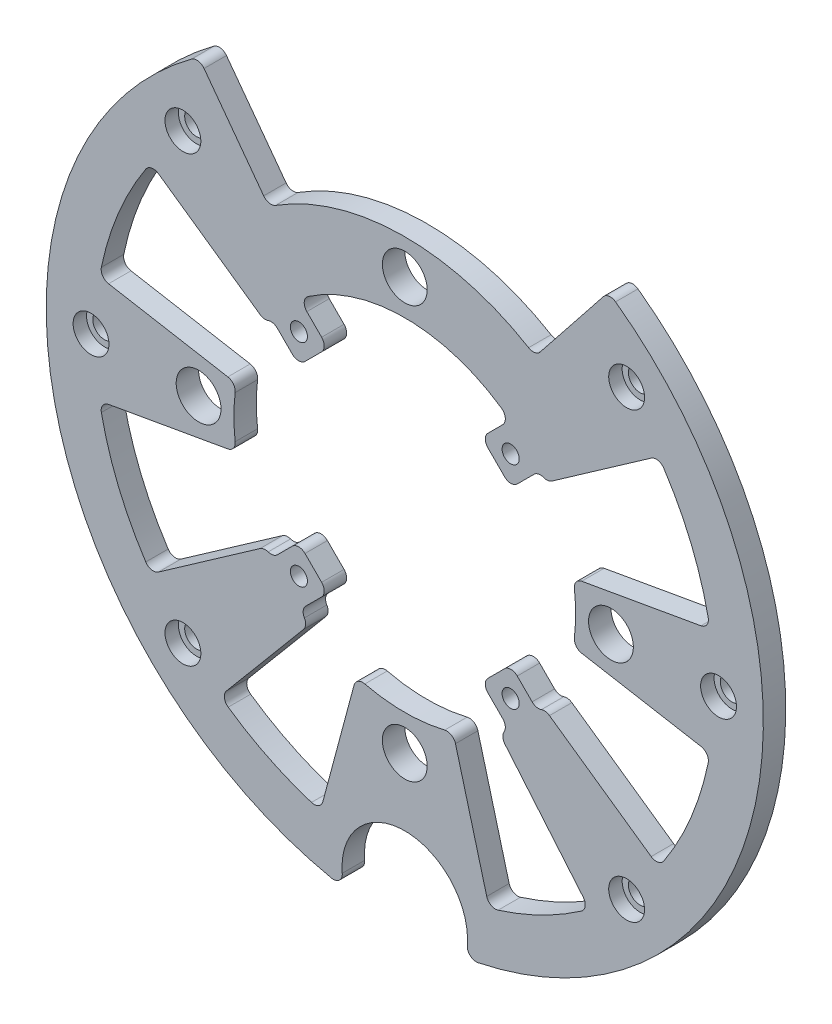
from build123d import *

# Parameters (mm, degrees)
SKETCH1_R                                        = 101.6
SKETCH1_R_2                                      = 48.435876627
EXTRUDE1_DEPTH                                   = 6.35
CBORE_FOR_1_4_SOCKET_HEAD_CAP_SCREW1_D           = 6.6294
CBORE_FOR_1_4_SOCKET_HEAD_CAP_SCREW1_CBORE_D     = 10.16
CBORE_FOR_1_4_SOCKET_HEAD_CAP_SCREW1_CBORE_DEPTH = 3.81
SKETCH11_R                                       = 17.78
CUT_EXTRUDE1_DEPTH                               = 144.824345992
SKETCH12_R                                       = 6.35
CUT_EXTRUDE2_DEPTH                               = 144.824345992
SKETCH13_R                                       = 2.426498152
EXTRUDE2_DEPTH                                   = 6.35
CUT_EXTRUDE3_DEPTH                               = 6.35
FILLET1_R                                        = 2.54
FILLET2_R                                        = 2.54
FILLET3_R                                        = 2.54
FILLET4_R                                        = 2.54
FILLET5_R                                        = 2.54
FILLET6_R                                        = 2.54
FILLET9_R                                        = 2.54


with BuildPart() as part:
    # Sketch1 → Extrude1 (new body)
    with BuildSketch(Plane.XY):
        Circle(SKETCH1_R)
        Circle(SKETCH1_R_2, mode=Mode.SUBTRACT)
    extrude(amount=EXTRUDE1_DEPTH)

    # CBORE for 1/4 Socket Head Cap Screw1 (through all)
    with Locations(Plane.XY.offset(6.35)):
        with Locations((62.861792847, -62.861792847), (88.9, 0), (62.861792847, 62.861792847), (-62.861792847, 62.861792847), (-88.9, 0), (-62.861792847, -62.861792847)):
            CounterBoreHole(CBORE_FOR_1_4_SOCKET_HEAD_CAP_SCREW1_D / 2, CBORE_FOR_1_4_SOCKET_HEAD_CAP_SCREW1_CBORE_D / 2, CBORE_FOR_1_4_SOCKET_HEAD_CAP_SCREW1_CBORE_DEPTH)

    # Sketch11 → Cut-Extrude1 (cut, through all)
    with BuildSketch(Plane.XY.offset(6.35)):
        with Locations((0, -95.25)):
            Circle(SKETCH11_R)
    extrude(amount=-CUT_EXTRUDE1_DEPTH, mode=Mode.SUBTRACT)

    # Sketch12 → Cut-Extrude2 (cut, through all)
    with BuildSketch(Plane.XY.offset(6.35)):
        with Locations((0, -58.42)):
            Circle(SKETCH12_R)
        with Locations((-58.42, 0)):
            Circle(SKETCH12_R)
        with Locations((58.42, 0)):
            Circle(SKETCH12_R)
        with Locations(Location((0, 58.42, 0), (0, 0, 180))):
            Circle(SKETCH12_R)
    extrude(amount=-CUT_EXTRUDE2_DEPTH, mode=Mode.SUBTRACT)

    # Sketch13 → Extrude2 (add)
    # profile 1 of 4: a face of its own
    with BuildSketch(Plane.XY.offset(6.35)):
        Polygon((30.067243726, -21.76182967), (44.903973325, -36.598559269), (36.598559269, -44.903973325), (21.76182967, -30.067243726), align=None)
        with Locations((29.99994, -29.99994)):
            Circle(SKETCH13_R, mode=Mode.SUBTRACT)
    # profile 2 of 4: a face of its own
    with BuildSketch(Plane.XY.offset(6.35)):
        Polygon((-30.067243726, -21.76182967), (-44.903973325, -36.598559269), (-36.598559269, -44.903973325), (-21.76182967, -30.067243726), align=None)
        with Locations((-29.99994, -29.99994)):
            Circle(SKETCH13_R, mode=Mode.SUBTRACT)
    # profile 3 of 4: a face of its own
    with BuildSketch(Plane.XY.offset(6.35)):
        Polygon((-30.067243726, 21.76182967), (-21.76182967, 30.067243726), (-36.598559269, 44.903973325), (-44.903973325, 36.598559269), align=None)
        with Locations((-29.99994, 29.99994)):
            Circle(SKETCH13_R, mode=Mode.SUBTRACT)
    # profile 4 of 4: a face of its own
    with BuildSketch(Plane.XY.offset(6.35)):
        Polygon((30.067243726, 21.76182967), (21.76182967, 30.067243726), (36.598559269, 44.903973325), (44.903973325, 36.598559269), align=None)
        with Locations((29.99994, 29.99994)):
            Circle(SKETCH13_R, mode=Mode.SUBTRACT)
    extrude(amount=-EXTRUDE2_DEPTH)

    # Sketch14 → Cut-Extrude3 (cut)
    with BuildSketch(Plane.XY.offset(6.35)):
        with BuildLine():
            Line((36.978423652, 57.45466439), (71.6832833, 101.141012966))
            Line((71.6832833, 101.141012966), (0, 148.475476712))
            Line((0, 148.475476712), (-71.6832833, 101.141012966))
            Line((-71.6832833, 101.141012966), (-38.544806548, 56.41577939))
            ThreePointArc((-38.544806548, 56.41577939), (-0.939792187, 68.319536493), (36.978423652, 57.45466439))
        make_face()
        with BuildLine():
            Line((8.652633897, -27.580853172), (23.900424698, -84.486383146))
            ThreePointArc((23.900424698, -84.486383146), (38.731626442, -78.797464115), (52.295107345, -70.52943347))
            Line((52.295107345, -70.52943347), (14.227637724, -25.162389788))
            ThreePointArc((14.227637724, -25.162389788), (11.503866682, -26.518532886), (8.652633897, -27.580853172))
        make_face()
        with BuildLine():
            Line((-71.923131973, 50.361119179), (-23.678617266, 16.579946304))
            ThreePointArc((-23.678617266, 16.579946304), (-26.705896668, 11.061944595), (-28.467103301, 5.019518375))
            Line((-28.467103301, 5.019518375), (-86.468023222, 15.246645463))
            ThreePointArc((-86.468023222, 15.246645463), (-81.118407757, 33.600344651), (-71.923131973, 50.361119179))
        make_face()
        with BuildLine():
            Line((-8.652154992, -27.581003409), (-23.900424698, -84.486383146))
            ThreePointArc((-23.900424698, -84.486383146), (-38.731626442, -78.797464115), (-52.295107345, -70.52943347))
            Line((-52.295107345, -70.52943347), (-14.229539169, -25.161314554))
            ThreePointArc((-14.229539169, -25.161314554), (-11.504638432, -26.518198083), (-8.652154992, -27.581003409))
        make_face()
        with BuildLine():
            Line((-86.468023222, -15.246645463), (-28.467103301, -5.019518375))
            ThreePointArc((-28.467103301, -5.019518375), (-26.705896668, -11.061944595), (-23.678617266, -16.579946304))
            Line((-23.678617266, -16.579946304), (-71.923131973, -50.361119179))
            ThreePointArc((-71.923131973, -50.361119179), (-81.118407757, -33.600344651), (-86.468023222, -15.246645463))
        make_face()
        with BuildLine():
            Line((23.678617266, -16.579946304), (71.923131973, -50.361119179))
            ThreePointArc((71.923131973, -50.361119179), (81.118407757, -33.600344651), (86.468023222, -15.246645463))
            Line((86.468023222, -15.246645463), (28.467103301, -5.019518375))
            ThreePointArc((28.467103301, -5.019518375), (26.705896668, -11.061944595), (23.678617266, -16.579946304))
        make_face()
        with BuildLine():
            Line((28.467103301, 5.019518375), (86.468023222, 15.246645463))
            ThreePointArc((86.468023222, 15.246645463), (81.118407757, 33.600344651), (71.923131973, 50.361119179))
            Line((71.923131973, 50.361119179), (23.678617266, 16.579946304))
            ThreePointArc((23.678617266, 16.579946304), (26.705896668, 11.061944595), (28.467103301, 5.019518375))
        make_face()
    extrude(amount=-CUT_EXTRUDE3_DEPTH, mode=Mode.SUBTRACT)

    # Fillet1
    fillet1_edges = [part.edges().sort_by_distance(p)[0] for p in [
        (-21.76182967, -30.067243726, 3.175),
        (-30.067243726, -21.76182967, 3.175),
        (-21.76182967, 30.067243726, 3.175),
        (-30.067243726, 21.76182967, 3.175),
        (21.76182967, 30.067243726, 3.175),
        (30.067243726, 21.76182967, 3.175),
        (-58.363526169, 83.1640476, 3.175),
        (52.295107345, -70.52943347, 3.175),
        (23.900424698, -84.486383146, 3.175),
        (-23.900424698, -84.486383146, 3.175),
        (-52.295107345, -70.52943347, 3.175),
        (47.700026827, -8.41080171, 3.175),
        (86.468023222, -15.246645463, 3.175),
        (71.923131973, -50.361119179, 3.175),
        (-71.923131973, -50.361119179, 3.175),
        (-86.468023222, -15.246645463, 3.175),
        (71.923131973, 50.361119179, 3.175),
        (86.468023222, 15.246645463, 3.175),
        (-86.468023222, 15.246645463, 3.175),
        (-71.923131973, 50.361119179, 3.175),
        (29.843941288, -38.149355343, 3.175),
        (30.067243726, -21.76182967, 3.175),
        (21.76182967, -30.067243726, 3.175),
    ]]
    fillet(fillet1_edges, radius=FILLET1_R)

    # Fillet2
    # the kernel refuses this fillet: 2.54 mm, written as the material it adds along each edge
    with BuildSketch(Plane(origin=(-38.149355343, -29.843941288, 6.35), x_dir=(0.7071067811865481, 0.7071067811865469, 0), z_dir=(0, 0, -1))) as fillet2_piece_1:
        with BuildLine():
            CenterArc((2.918493499, -2.54), FILLET2_R, 90, 89.954594463)
            ThreePointArc((0.378494296, -2.537987111), (0.172436891, -1.271500497), (0, 0))
            Line((0, 0), (2.918493499, 0))
        make_face()
    extrude(amount=6.35)
    # the kernel refuses this fillet: 2.54 mm, written as the material it takes off along each edge
    with BuildSketch(Plane(origin=(39.676347356, 27.781677508, 12.541699401), x_dir=(0.8191520442889919, 0.5735764363510458, 0), z_dir=(0, 0, -1))) as fillet2_2_piece_1:
        with BuildLine():
            CenterArc((2.47667976, -2.54), FILLET2_R, 90, 87.143912429)
            ThreePointArc((-0.060165151, -2.413438175), (-0.015043624, -1.207093997), (0, 0))
            Line((0, 0), (2.47667976, 0))
        make_face()
    extrude(amount=18.733398802, mode=Mode.SUBTRACT)

    # Fillet3
    # the kernel refuses this fillet: 2.54 mm, written as the material it adds along each edge
    with BuildSketch(Plane(origin=(38.149355343, -29.843941288, 6.35), x_dir=(-0.7071067811865487, 0.7071067811865462, 0), z_dir=(0, 0, -1))) as fillet3_piece_1:
        with BuildLine():
            CenterArc((2.918493499, 2.54), FILLET3_R, 180.045405537, 89.954594463)
            ThreePointArc((0.378494296, 2.537987111), (0.172436891, 1.271500497), (0, 0))
            Line((0, 0), (2.918493499, 0))
        make_face()
    extrude(amount=6.35)
    with BuildSketch(Plane(origin=(-29.843941288, 38.149355343, 6.35), x_dir=(0.8065806519344794, 0.5911240579818674, 0), z_dir=(0, 0, -1))) as fillet3_piece_2:
        with BuildLine():
            CenterArc((2.961349729, 2.538748086), FILLET3_R, 171.236815401, 100.562162322)
            Line((0.451000474, 2.925719166), (0, 0))
            ThreePointArc((0, 0), (1.52054388, -0.023873044), (3.041087761, 0))
        make_face()
    extrude(amount=6.35)
    # the kernel refuses this fillet: 2.54 mm, written as the material it takes off along each edge
    with BuildSketch(Plane(origin=(26.907852458, -40.274081253, 12.135832501), x_dir=(0.6427876096865419, -0.7660444431189757, 0), z_dir=(0, 0, -1))) as fillet3_2_piece_1:
        with BuildLine():
            CenterArc((2.314333001, -2.54), FILLET3_R, 90, 70.288335328)
            Line((-0.076827818, -1.683291217), (-0.3159439, -1.597620338))
            ThreePointArc((-0.3159439, -1.597620338), (-0.19275198, -0.605010424), (-0.252489157, -0.027662711))
            Line((-0.252489157, -0.027662711), (0, 0.254))
            Line((0, 0.254), (2.314333001, 0.254))
            Line((2.314333001, 0.254), (2.314333001, 0))
        make_face()
    extrude(amount=17.921665003, mode=Mode.SUBTRACT)
    with BuildSketch(Plane(origin=(13.709958303, -46.455044807, 12.695601727), x_dir=(-0.9660206148643552, -0.2584650298533501, 0), z_dir=(0, 0, -1))) as fillet3_2_piece_2:
        with BuildLine():
            CenterArc((2.539069601, -2.539171394), FILLET3_R, 91.463547204, 88.51545472)
            Line((-0.000930229, -2.53824052), (0, 0))
            ThreePointArc((0, 0), (1.237097807, -0.015800898), (2.474195614, 0))
        make_face()
    extrude(amount=19.041203453, mode=Mode.SUBTRACT)

    # Fillet4
    # the kernel refuses this fillet: 2.54 mm, written as the material it adds along each edge
    with BuildSketch(Plane(origin=(-38.149355343, 29.843941288, 6.35), x_dir=(0.7071067811865475, -0.7071067811865475, 0), z_dir=(0, 0, -1))) as fillet4_piece_1:
        with BuildLine():
            CenterArc((2.918493499, 2.54), FILLET4_R, 180.045405537, 89.954594463)
            ThreePointArc((0.378494296, 2.537987111), (0.172436891, 1.271500497), (0, 0))
            Line((0, 0), (2.918493499, 0))
        make_face()
    extrude(amount=6.35)
    # the kernel refuses this fillet: 2.54 mm, written as the material it takes off along each edge
    with BuildSketch(Plane(origin=(57.744565526, 83.595006742, 12.437099137), x_dir=(0.8159161636630297, -0.5781702291483056, 0), z_dir=(0, 0, -1))) as fillet4_2_piece_1:
        with BuildLine():
            CenterArc((2.404404159, 2.539817647), FILLET4_R, 183.142021244, 87.544540639)
            Line((-0.13177756, 2.400597366), (0, 0))
            ThreePointArc((0, 0), (1.217419827, -0.007294115), (2.434839655, 0))
        make_face()
    extrude(amount=18.524198273, mode=Mode.SUBTRACT)
    with BuildSketch(Plane(origin=(39.676347356, -27.781677508, 10.377126904), x_dir=(-0.8480711193304972, -0.5298824176716165, 0), z_dir=(0, 0, -1))) as fillet4_2_piece_2:
        with BuildLine():
            CenterArc((1.708565245, -2.475327247), FILLET4_R, 102.957083854, 54.040426754)
            Line((-0.62947396, -1.482768596), (0, 0))
            ThreePointArc((0, 0), (0.569521748, -0.064672753), (1.139043497, 0))
        make_face()
    extrude(amount=14.404253807, mode=Mode.SUBTRACT)
    with BuildSketch(Plane(origin=(-47.700026827, -8.41080171, 12.541699401), x_dir=(-0.14905137241774008, 0.988829453637172, 0), z_dir=(0, 0, -1)), Plane(origin=(47.700026827, 8.41080171, 12.541699401), x_dir=(0.14905137241774133, -0.9888294536371718, 0), z_dir=(0, 0, -1))) as fillet4_2_piece_3:
        with BuildLine():
            CenterArc((2.477488567, -2.539211105), FILLET4_R, 91.428043786, 87.143912429)
            Line((-0.061722539, -2.475910532), (0, 0))
            ThreePointArc((0, 0), (1.207093997, -0.015043624), (2.414187993, 0))
        make_face()
    extrude(amount=18.733398802, mode=Mode.SUBTRACT)
    with BuildSketch(Plane(origin=(17.09084068, -100.1522, 15.702548989), x_dir=(0.18100537272748396, 0.9834821071294508, 0), z_dir=(0, 0, -1))) as fillet4_2_piece_4:
        with BuildLine():
            CenterArc((3.702197139, 2.527980078), FILLET4_R, 157.777700038, 106.646039912)
            ThreePointArc((1.35085956, 3.488610908), (0.659371626, 1.750523491), (0, 0))
            ThreePointArc((0, 0), (1.727691998, 0.084139457), (3.455383996, 0))
        make_face()
    extrude(amount=25.055097979, mode=Mode.SUBTRACT)

    # Fillet5
    fillet5_edges = [part.edges().sort_by_distance(p)[0] for p in [
        (-26.909050546, -40.273280762, 3.175),
        (-13.709636762, -46.4551397, 3.175),
        (-39.676347356, 27.781677508, 3.175),
        (-47.700026827, 8.41080171, 3.175),
        (-17.09084068, -100.1522, 3.175),
    ]]
    fillet(fillet5_edges, radius=FILLET5_R)

    # Fillet6
    fillet6_edges = [part.edges().sort_by_distance(p)[0] for p in [
        (-29.843941288, -38.149355343, 3.175),
        (-39.676347356, -27.781677508, 3.175),
        (38.149355343, 29.843941288, 3.175),
        (29.843941288, 38.149355343, 3.175),
    ]]
    fillet(fillet6_edges, radius=FILLET6_R)

    # Fillet9
    fillet9_edges = [part.edges().sort_by_distance(p)[0] for p in [
        (-38.544806548, 56.41577939, 3.175),
        (36.978423652, 57.45466439, 3.175),
    ]]
    fillet(fillet9_edges, radius=FILLET9_R)


solid = part.part
